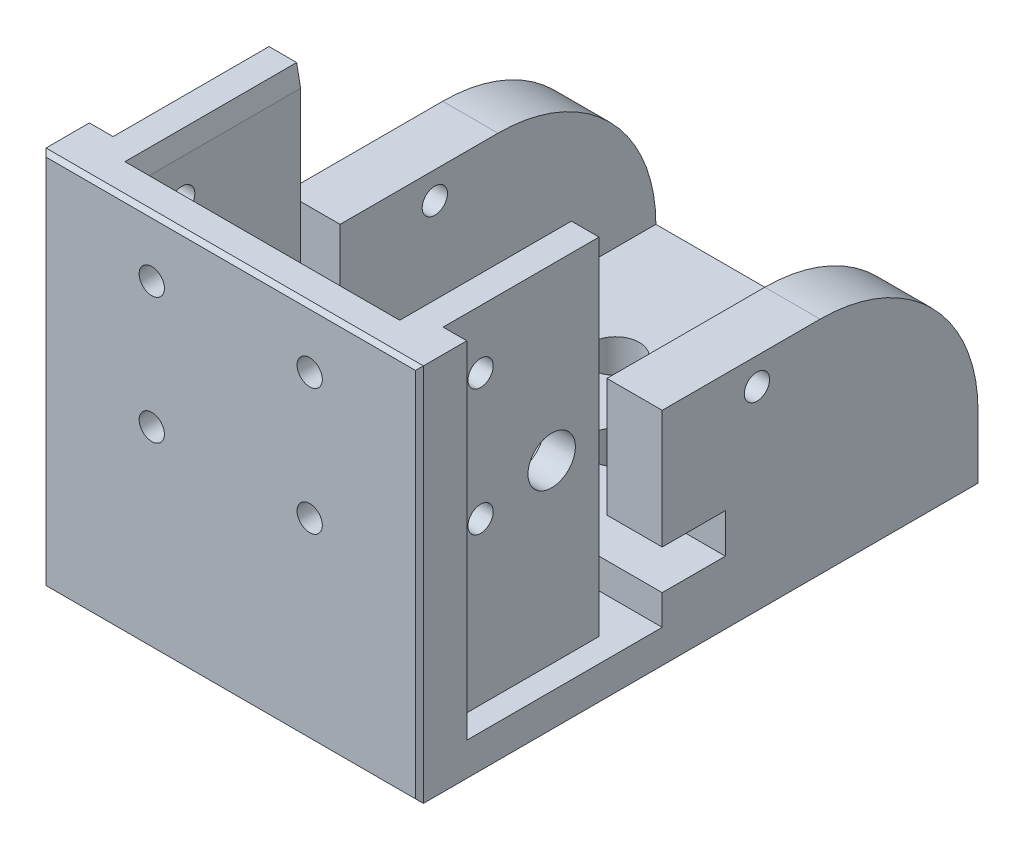
from build123d import *

# Parameters (mm, degrees)
EXTRUDE_1_DEPTH      = 40
SKETCH_1_3_W         = 33.8
SKETCH_1_3_H         = 23.75
SKETCH_1_3_R         = 1.6
EXTRUDE_2_DEPTH      = 8
SKETCH_4_R           = 1.6
CUT_EXTRUDE_1_DEPTH  = 82.129560735
SKETCH_8_W           = 4
SKETCH_8_H           = 43
EXTRUDE_3_DEPTH      = 20
EXTRUDE_START        = 3
SKETCH_11_R          = 1.6
EXTRUDE_5_DEPTH      = 3
SKETCH_12_R          = 1.6
EXTRUDE_6_DEPTH      = 3
FILLET_4_R           = 20
SKETCH_10_R          = 1.6
CUT_EXTRUDE_4_DEPTH  = 85.377755511
CHAMFER_1_SIZE       = 0.5
CHAMFER_1_SIZE2      = 2.572277008
HOLE_WIZARD_M3_1_D   = 3.2
SKETCH_14_W          = 5
SKETCH_14_H          = 48.410238409
CUT_EXTRUDE_6_DEPTH  = 10
CUT_EXTRUDE_11_REACH = 80.166
SKETCH_22_W          = 5.804167704
SKETCH_22_H          = 22.848634954
CHAMFER_2_SIZE       = 0.5
SKETCH_13_W          = 13
SKETCH_13_H          = 5
CUT_EXTRUDE_5_DEPTH  = 53
SKETCH_17_R          = 3
CUT_EXTRUDE_8_DEPTH  = 85.377755511
SKETCH_19_W          = 25
SKETCH_19_H          = 25
EXTRUDE_7_DEPTH      = 7
SKETCH_20_W          = 15.2
SKETCH_20_H          = 15.2
EXTRUDE_8_DEPTH      = 2
CHAMFER_3_SIZE       = 2
SKETCH_21_R          = 1.6
CUT_EXTRUDE_10_DEPTH = 74.52534002
SKETCH_18_R          = 3
CUT_EXTRUDE_9_DEPTH  = 6
CHAMFER_5_SIZE       = 7


with BuildPart() as part:
    # 草图1 → 凸台-拉伸1 (new body)
    with BuildSketch(Plane(origin=(0, 0, 0), x_dir=(1, 0, 0), z_dir=(0, 1, 0))):
        Polygon((-16.9, -9.875), (-16.9, 13.875), (-20.9, 13.875), (-20.9, -13.875), (20.9, -13.875), (20.9, 13.875), (16.9, 13.875), (16.9, -9.875), align=None)
    extrude(amount=EXTRUDE_1_DEPTH)

    # 草图1<3> → 凸台-拉伸2 (add)
    # profile 1 of 3: a face of its own
    with BuildSketch(Plane(origin=(0, 0, 0), x_dir=(1, 0, 0), z_dir=(0, 1, 0))):
        with Locations((0, 2)):
            Rectangle(SKETCH_1_3_W, SKETCH_1_3_H)
    # profile 2 of 3: a face of its own
    with BuildSketch(Plane(origin=(0, 0, 0), x_dir=(1, 0, 0), z_dir=(0, 1, 0))):
        Polygon((-20.9, 13.875), (-16.9, 13.875), (16.9, 13.875), (20.9, 13.875), (20.9, 56.875), (-20.9, 56.875), align=None)
        with Locations(Location((-5, 29.875, 0), (0, 0, 270))):
            Circle(SKETCH_1_3_R, mode=Mode.SUBTRACT)
        with Locations(Location((-5, 39.875, 0), (0, 0, 270))):
            Circle(SKETCH_1_3_R, mode=Mode.SUBTRACT)
        with Locations(Location((5, 29.875, 0), (0, 0, 270))):
            Circle(SKETCH_1_3_R, mode=Mode.SUBTRACT)
        with Locations(Location((5, 39.875, 0), (0, 0, 270))):
            Circle(SKETCH_1_3_R, mode=Mode.SUBTRACT)
    # profile 3 of 3: a face of its own
    with BuildSketch(Plane(origin=(0, 0, 0), x_dir=(1, 0, 0), z_dir=(0, 1, 0))):
        Polygon((-16.9, -9.875), (-16.9, 13.875), (-20.9, 13.875), (-20.9, -13.875), (20.9, -13.875), (20.9, 13.875), (16.9, 13.875), (16.9, -9.875), align=None)
    extrude(amount=-EXTRUDE_2_DEPTH)

    # 草图4 → 切除-拉伸1 (cut, through all)
    with BuildSketch(Plane(origin=(20.9, 0, 0), x_dir=(0, 0, -1), z_dir=(1, 0, 0))):
        with Locations((-3.125, 16.6)):
            Circle(SKETCH_4_R)
        with Locations((-3.125, 32.6)):
            Circle(SKETCH_4_R)
    extrude(amount=-CUT_EXTRUDE_1_DEPTH, mode=Mode.SUBTRACT)

    # 草图8 → 凸台-拉伸3 (add)
    with BuildSketch(Plane(origin=(0, 0, 0), x_dir=(1, 0, 0), z_dir=(0, 1, 0))):
        with Locations((18.9, 35.375)):
            Rectangle(SKETCH_8_W, SKETCH_8_H)
        with Locations((-18.9, 35.375)):
            Rectangle(SKETCH_8_W, SKETCH_8_H)
    extrude(amount=EXTRUDE_3_DEPTH)

    # 草图11 → 凸台-拉伸5 (add)
    with BuildSketch(Plane(origin=(20.9, 0, 0), x_dir=(0, 0, -1), z_dir=(1, 0, 0)).offset(EXTRUDE_START)):
        Polygon((-13.875, 40), (13.875, 40), (13.875, 20), (56.875, 20), (56.875, -8), (-13.875, -8), align=None)
        with Locations((-3.125, 32.6)):
            Circle(SKETCH_11_R, mode=Mode.SUBTRACT)
        with Locations((-3.125, 16.6)):
            Circle(SKETCH_11_R, mode=Mode.SUBTRACT)
    extrude(amount=-EXTRUDE_5_DEPTH)

    # 草图12 → 凸台-拉伸6 (add)
    with BuildSketch(Plane.ZY.offset(20.9)):
        Polygon((-13.875, 40), (13.875, 40), (13.875, -8), (-56.875, -8), (-56.875, 20), (-13.875, 20), align=None)
        with Locations(Location((3.125, 32.6, 0), (0, 0, 180))):
            Circle(SKETCH_12_R, mode=Mode.SUBTRACT)
        with Locations(Location((3.125, 16.6, 0), (0, 0, 180))):
            Circle(SKETCH_12_R, mode=Mode.SUBTRACT)
    extrude(amount=EXTRUDE_6_DEPTH)

    # 圆角4
    fillet_4_edges = [part.edges().sort_by_distance(p)[0] for p in [
        (20.4, 20, -56.875),
        (-20.4, 20, -56.875),
    ]]
    fillet(fillet_4_edges, radius=FILLET_4_R)

    # 草图10 → 切除-拉伸4 (cut, through all)
    with BuildSketch(Plane.ZY.offset(23.9)):
        with Locations((-28.875, 16.6)):
            Circle(SKETCH_10_R)
    extrude(amount=-CUT_EXTRUDE_4_DEPTH, mode=Mode.SUBTRACT)

    # 倒角1
    chamfer_1_edges = [part.edges().sort_by_distance(p)[0] for p in [
        (-16.9, 40, -2),
        (16.9, 40, -2),
    ]]
    chamfer_1_side = [part.faces().sort_by_distance(p)[0] for p in [
        (-17.452711724, 40, -2),
    ]]
    chamfer(chamfer_1_edges, length=CHAMFER_1_SIZE, length2=CHAMFER_1_SIZE2, reference=chamfer_1_side[0])

    # M3 间隙孔1 (through all)
    with Locations(Plane.XY.offset(13.875)):
        with Locations((-10, 32.6), (-10, 16.6), (10, 16.6), (10, 32.6)):
            Hole(HOLE_WIZARD_M3_1_D / 2)

    # 草图14 → 切除-拉伸6 (cut)
    with BuildSketch(Plane(origin=(23.9, 0, 0), x_dir=(0, 0, -1), z_dir=(1, 0, 0))):
        with Locations((14.375, 20.3953107)):
            Rectangle(SKETCH_14_W, SKETCH_14_H)
    cut_extrude_6 = extrude(amount=-CUT_EXTRUDE_6_DEPTH, mode=Mode.SUBTRACT)

    # 切除-拉伸11: up to this face of the body (flat: up to its plane)
    cut_extrude_11_end = Plane(part.part.faces().sort_by_distance((18.9, -3.809808505, -14.375))[0])
    # 草图22 → 切除-拉伸11 (cut, up to the picked face)
    with BuildSketch(Plane(origin=(0, 40, 0), x_dir=(1, 0, 0), z_dir=(0, 1, 0)), mode=Mode.PRIVATE) as cut_extrude_11_sk1:
        with Locations((23.802083852, 3.549317477)):
            Rectangle(SKETCH_22_W, SKETCH_22_H)
    cut_extrude_11_tool1 = split(extrude(cut_extrude_11_sk1.sketch, amount=-CUT_EXTRUDE_11_REACH, mode=Mode.PRIVATE), bisect_by=cut_extrude_11_end, keep=Keep.BOTH, mode=Mode.PRIVATE)
    cut_extrude_11 = cut_extrude_11_tool1.solids().sort_by(Axis((23.802084, 40, -3.549317), (0, -1, 0)))[0]
    add(cut_extrude_11, mode=Mode.SUBTRACT)

    # 镜向1: 切除-拉伸6, 切除-拉伸11 across plane
    add(cut_extrude_6.mirror(Plane(origin=(0, 0, 0), x_dir=(0, 0, 1), z_dir=(1, 0, 0))), mode=Mode.SUBTRACT)
    add(cut_extrude_11.mirror(Plane(origin=(0, 0, 0), x_dir=(0, 0, 1), z_dir=(1, 0, 0))), mode=Mode.SUBTRACT)

    # 倒角2
    chamfer_2_edges = [part.edges().sort_by_distance(p)[0] for p in [
        (-23.9, 16, 13.875),
        (0, -8, 13.875),
        (0, 40, 13.875),
        (23.9, 16, 13.875),
    ]]
    chamfer(chamfer_2_edges, length=CHAMFER_2_SIZE)

    # 草图13 → 切除-拉伸5 (cut)
    with BuildSketch(Plane(origin=(23.9, 0, 0), x_dir=(0, 0, -1), z_dir=(1, 0, 0))):
        with Locations((18.375, 2.5)):
            Rectangle(SKETCH_13_W, SKETCH_13_H)
    extrude(amount=-CUT_EXTRUDE_5_DEPTH, mode=Mode.SUBTRACT)

    # 草图17 → 切除-拉伸8 (cut, through all)
    with BuildSketch(Plane(origin=(23.9, 0, 0), x_dir=(0, 0, -1), z_dir=(1, 0, 0))):
        with Locations((5.875, 18.5)):
            Circle(SKETCH_17_R)
    extrude(amount=-CUT_EXTRUDE_8_DEPTH, mode=Mode.SUBTRACT)

    # 草图19 → 凸台-拉伸7 (add)
    with BuildSketch(Plane.XZ.offset(8)):
        with Locations((0, -34.875)):
            Rectangle(SKETCH_19_W, SKETCH_19_H)
    extrude(amount=EXTRUDE_7_DEPTH)

    # 草图20 → 凸台-拉伸8 (add)
    with BuildSketch(Plane.XZ.offset(15)):
        with Locations((0, -34.875)):
            Rectangle(SKETCH_20_W, SKETCH_20_H)
    extrude(amount=EXTRUDE_8_DEPTH)

    # 倒角3
    chamfer_3_edges = [part.edges().sort_by_distance(p)[0] for p in [
        (7.6, -15, -34.875),
        (0, -15, -42.475),
        (-7.6, -15, -34.875),
        (0, -15, -27.275),
    ]]
    chamfer(chamfer_3_edges, length=CHAMFER_3_SIZE - 0.0001)  # a hair under: the kernel refuses the full size

    # 草图21 → 切除-拉伸10 (cut, through all)
    with BuildSketch(Plane(origin=(0, 0, 0), x_dir=(1, 0, 0), z_dir=(0, 1, 0))):
        with Locations(Location((-5, 39.875, 0), (0, 0, 270))):
            Circle(SKETCH_21_R)
        with Locations(Location((5, 39.875, 0), (0, 0, 270))):
            Circle(SKETCH_21_R)
        with Locations(Location((5, 29.875, 0), (0, 0, 270))):
            Circle(SKETCH_21_R)
        with Locations(Location((-5, 29.875, 0), (0, 0, 270))):
            Circle(SKETCH_21_R)
    extrude(amount=-CUT_EXTRUDE_10_DEPTH, mode=Mode.SUBTRACT)

    # 草图18 → 切除-拉伸9 (cut)
    with BuildSketch(Plane(origin=(0, 0, 0), x_dir=(1, 0, 0), z_dir=(0, 1, 0))):
        with Locations(Location((-5, 39.875, 0), (0, 0, 270))):
            Circle(SKETCH_18_R)
        with Locations(Location((5, 39.875, 0), (0, 0, 270))):
            Circle(SKETCH_18_R)
        with Locations(Location((5, 29.875, 0), (0, 0, 270))):
            Circle(SKETCH_18_R)
        with Locations(Location((-5, 29.875, 0), (0, 0, 270))):
            Circle(SKETCH_18_R)
    extrude(amount=-CUT_EXTRUDE_9_DEPTH, mode=Mode.SUBTRACT)

    # 倒角5
    chamfer_5_edges = [part.edges().sort_by_distance(p)[0] for p in [
        (-12.5, -8, -34.875),
        (0, -8, -47.375),
        (12.5, -8, -34.875),
        (0, -8, -22.375),
    ]]
    chamfer(chamfer_5_edges, length=CHAMFER_5_SIZE - 0.0001)  # a hair under: the kernel refuses the full size


solid = part.part
